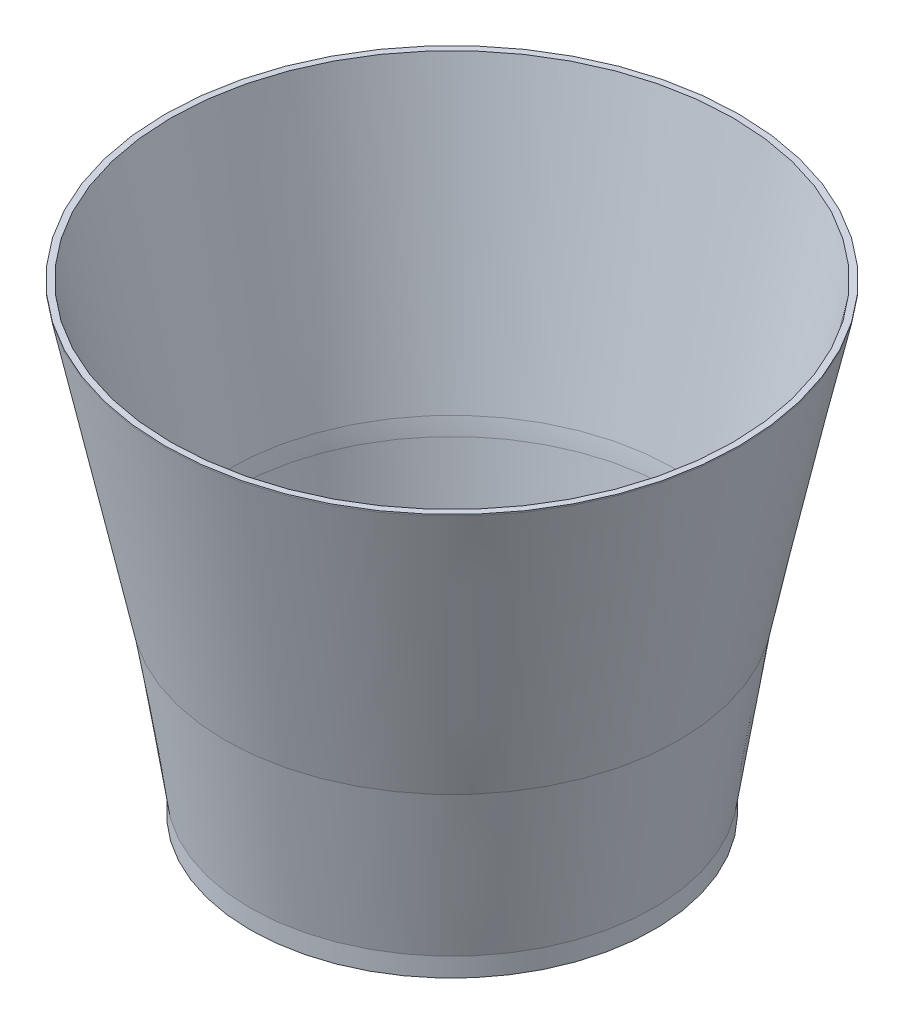
from build123d import *

# Parameters (mm, degrees)
SKETCH1_R           = 32
SKETCH1_R_2         = 2
SKETCH1_R_3         = 4
BOSS_EXTRUDE1_DEPTH = 3
FILLET1_R           = 50


with BuildPart() as part:
    # Sketch1 → Boss-Extrude1 (new body)
    with BuildSketch(Plane(origin=(0, 0, 0), x_dir=(1, 0, 0), z_dir=(0, 1, 0))):
        Circle(SKETCH1_R)
        with Locations((-1.059314884, 9.943734308)):
            Circle(SKETCH1_R_2, mode=Mode.SUBTRACT)
        with Locations((0.529657432, -4.971867154)):
            Circle(SKETCH1_R_2, mode=Mode.SUBTRACT)
        with Locations((0, 21.162401824)):
            Circle(SKETCH1_R_3, mode=Mode.SUBTRACT)
        with Locations((16.54543199, 13.19454172)):
            Circle(SKETCH1_R_3, mode=Mode.SUBTRACT)
        with Locations((20.631816227, -4.709077419)):
            Circle(SKETCH1_R_3, mode=Mode.SUBTRACT)
        with Locations((9.182022032, -19.066665213)):
            Circle(SKETCH1_R_3, mode=Mode.SUBTRACT)
        with Locations((-9.182022032, -19.066665213)):
            Circle(SKETCH1_R_3, mode=Mode.SUBTRACT)
        with Locations((-20.631816227, -4.709077419)):
            Circle(SKETCH1_R_3, mode=Mode.SUBTRACT)
        with Locations((-16.54543199, 13.19454172)):
            Circle(SKETCH1_R_3, mode=Mode.SUBTRACT)
    extrude(amount=BOSS_EXTRUDE1_DEPTH)

    # Sketch3 → Revolve2 (revolve)
    with BuildSketch(Plane(origin=(0, 0, 0), x_dir=(0, 0, -1), z_dir=(1, 0, 0))):
        Polygon((-32, 3), (-35.959611008, 28), (-34.959611008, 28), (-30.524846679, 0), (-32, 0), align=None)
    revolve(axis=Axis((0, 0, 0), (0, 1, 0)))

    # Sketch5 → Revolve3 (revolve)
    with BuildSketch(Plane(origin=(0, 0, 0), x_dir=(0, 0, -1), z_dir=(1, 0, 0))):
        Polygon((-35.959611008, 28), (-45.524656283, 73), (-45.524656283, 73.207911691), (-44.546508683, 73.207911691), (-34.981463407, 28.207911691), (-34.959611008, 28), align=None)
    revolve(axis=Axis((0, 0, 0), (0, 1, 0)))

    # Fillet1
    fillet1_edges = [part.edges().sort_by_distance(p)[0] for p in [
        (0, 28.207911691, -34.981463407),
    ]]
    fillet(fillet1_edges, radius=FILLET1_R)


solid = part.part
